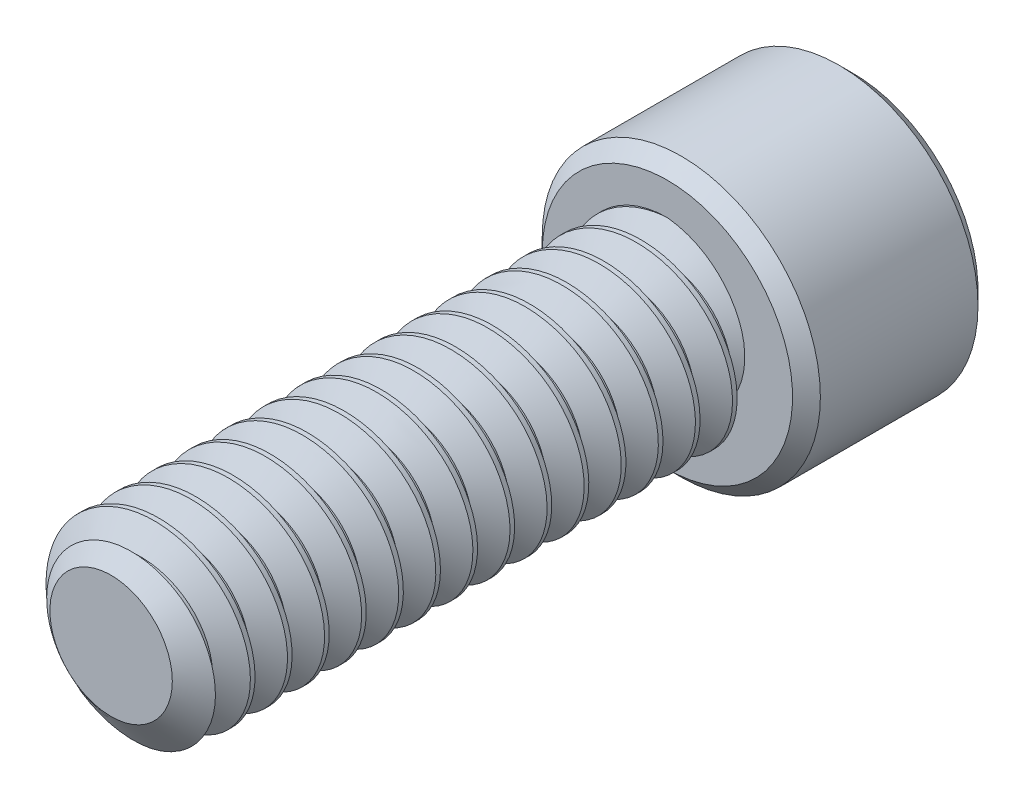
from build123d import *

# Parameters (mm, degrees)
SKETCH1_R          = 3.175
EXTRUDE1_DEPTH     = 19.05
CUT_SWEEP1_PITCH   = 1.27
SKETCH6_R          = 4.7625
EXTRUDE2_DEPTH     = 6.35
CUT_EXTRUDE1_DEPTH = 3.571875
CHAMFER1_SIZE      = 0.47625


with BuildPart() as part:
    # Sketch1 → Extrude1 (new body)
    with BuildSketch(Plane.XY):
        Circle(SKETCH1_R)
    extrude(amount=-EXTRUDE1_DEPTH)

    # Cut-Sweep1: the profile of Sketch3 profile screwed along a right-hand helix of 16 turns, 6 arcs to a turn; built about Z, then put on its axis
    cut_sweep1_z = Axis((0, 0, 0), (0, 0, 1))
    cut_sweep1_corners = [(3.1753, 0, -1.111423205), (2.350110803, 0, -0.635), (2.350110803, 0, -0.47625), (3.1753, 0, 0.000173205)]
    with BuildLine(mode=Mode.PRIVATE) as cut_sweep1_profile:
        Line(cut_sweep1_corners[0], cut_sweep1_corners[1])
        Line(cut_sweep1_corners[1], cut_sweep1_corners[2])
        Line(cut_sweep1_corners[2], cut_sweep1_corners[3])
        Line(cut_sweep1_corners[3], cut_sweep1_corners[0])
    cut_sweep1_cap = Face(cut_sweep1_profile.wire())
    cut_sweep1_turn_angles = [0, 30, 60, 90, 120, 150, 180, 210, 240, 270, 300, 330, 360]
    cut_sweep1_turn_weights = [1, 0.8660254037844387, 1, 0.8660254037844387, 1, 0.8660254037844387, 1, 0.8660254037844387, 1, 0.8660254037844387, 1, 0.8660254037844387, 1]
    cut_sweep1_turn_rails = [Edge.make_bspline([Vector(p[0], p[1], 0).rotate(cut_sweep1_z, cut_sweep1_turn_angles[k]) / cut_sweep1_turn_weights[k] + Vector(0, 0, p[2] + CUT_SWEEP1_PITCH * cut_sweep1_turn_angles[k] / 360) for k in range(13)], [0, 0, 0, 1, 1, 2, 2, 3, 3, 4, 4, 5, 5, 6, 6, 6], 2, cut_sweep1_turn_weights) for p in cut_sweep1_corners]
    cut_sweep1_turn_sides = [Face.make_surface_from_curves(cut_sweep1_turn_rails[p[0]], cut_sweep1_turn_rails[p[1]]) for p in [(0, 1), (1, 2), (2, 3), (3, 0)]]
    cut_sweep1 = Plane(origin=(0, 0, 0), x_dir=(0, 1, 0), z_dir=(0, 0, -1)) * Solid(Shell([*[p.moved(Location((0, 0, CUT_SWEEP1_PITCH * i))) for i in range(16) for p in cut_sweep1_turn_sides], cut_sweep1_cap, cut_sweep1_cap.rotate(cut_sweep1_z, 5760).moved(Location((0, 0, CUT_SWEEP1_PITCH * 5760 / 360)))]))
    add(cut_sweep1, mode=Mode.SUBTRACT)

    # Sketch4 → Cut-Revolve1 (revolve, cut)
    with BuildSketch(Plane(origin=(0, 0, 0), x_dir=(0, 0, -1), z_dir=(1, 0, 0)), mode=Mode.PRIVATE) as cut_revolve1_sk:
        Polygon((0.755446349, 3.175), (0, 2.096110803), (0, 3.175), align=None)
    revolve(cut_revolve1_sk.sketch.rotate(Axis((0, 0, 0), (0, 0, -1)), 229.892048011), axis=Axis((0, 0, 0), (0, 0, -1)), mode=Mode.SUBTRACT)

    # Sketch6 → Extrude2 (add)
    with BuildSketch(Plane(origin=(0, 0, -19.05), x_dir=(-1, 0, 0), z_dir=(0, 0, -1))):
        Circle(SKETCH6_R)
    extrude(amount=EXTRUDE2_DEPTH)

    # Sketch7 → Cut-Extrude1 (cut)
    with BuildSketch(Plane(origin=(0, 0, -25.4), x_dir=(-1, 0, 0), z_dir=(0, 0, -1))):
        Polygon((0, 2.749630657), (-2.38125, 1.374815329), (-2.38125, -1.374815329), (0, -2.749630657), (2.38125, -1.374815329), (2.38125, 1.374815329), align=None)
    extrude(amount=-CUT_EXTRUDE1_DEPTH, mode=Mode.SUBTRACT)

    # Cut-Extrude2 cone 1 section (through the dimple's axis) → Cut-Extrude2 (revolve, cut)
    with BuildSketch(Plane(origin=(0, 0, -25.4), x_dir=(0, 1, 0), z_dir=(1, 0, 0))):
        Polygon((0, 0), (2.749630657, 0), (0, 2.749630657), align=None)
    revolve(axis=Axis((0, 0, -25.4), (0, 0, 1)), mode=Mode.SUBTRACT)

    # Chamfer1
    chamfer1_edges = [part.edges().sort_by_distance(p)[0] for p in [
        (4.7625, 0, -19.05),
        (4.7625, 0, -25.4),
    ]]
    chamfer(chamfer1_edges, length=CHAMFER1_SIZE)


solid = part.part
